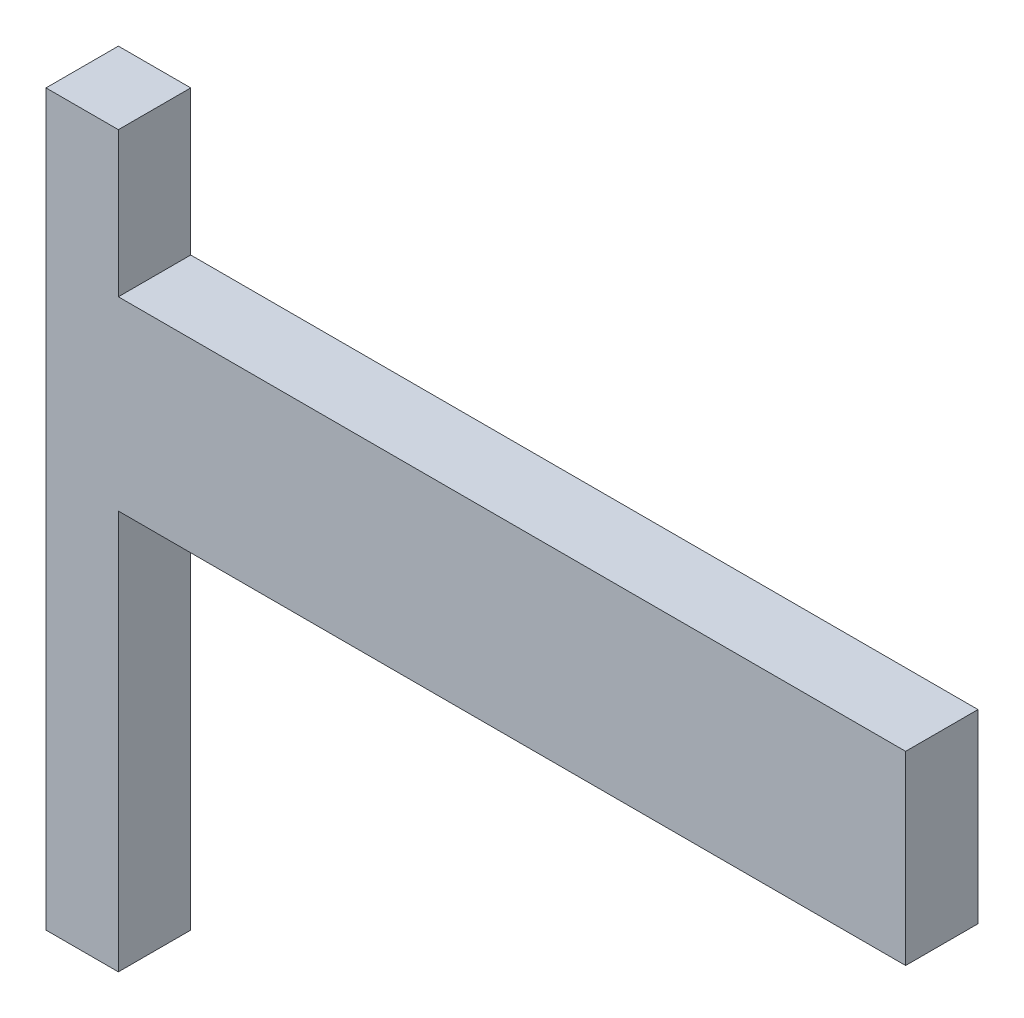
from build123d import *

# Parameters (mm, degrees)
BOSS_EXTRUDE1_DEPTH = 6.35


with BuildPart() as part:
    # Sketch2 → Boss-Extrude1 (new body)
    with BuildSketch(Plane.XY):
        Polygon((0, -45.00147748), (0, 0), (6.35, 0), (6.35, -12.7), (75.42710801, -12.7), (75.42710801, -28.978), (6.35, -28.978), (6.35, -63.9998), (0, -63.9998), align=None)
    extrude(amount=BOSS_EXTRUDE1_DEPTH)


solid = part.part
